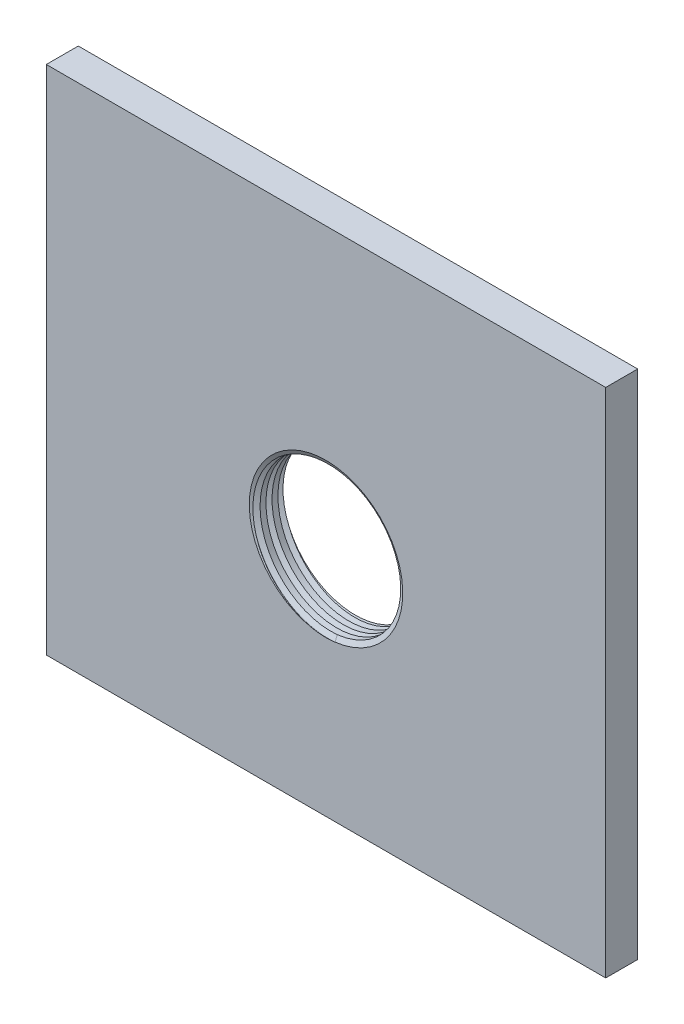
from build123d import *

# Parameters (mm, degrees)
SKETCH1_W           = 35
SKETCH1_H           = 35
BOSS_EXTRUDE1_DEPTH = 2
CUT_EXTRUDE1_REACH  = 51.538
SKETCH2_R           = 4.5
CUT_SWEEP9_PITCH    = 0.75
SKETCH26_W          = 35
SKETCH26_H          = 2
CUT_EXTRUDE4_DEPTH  = 3


with BuildPart() as part:
    # Sketch1 → Boss-Extrude1 (new body)
    with BuildSketch(Plane.XY):
        with Locations((17.5, 17.5)):
            Rectangle(SKETCH1_W, SKETCH1_H)
    extrude(amount=BOSS_EXTRUDE1_DEPTH)

    # Sketch2 → Cut-Extrude1 (cut, up to next)
    with BuildSketch(Plane.XY.offset(2), mode=Mode.PRIVATE) as cut_extrude1_sk1:
        with Locations((17.5, 17.5)):
            Circle(SKETCH2_R)
    cut_extrude1_tool1 = extrude(cut_extrude1_sk1.sketch, amount=-CUT_EXTRUDE1_REACH, mode=Mode.PRIVATE) & part.part
    add(cut_extrude1_tool1.solids().sort_by_distance((17.5, 17.5, 2))[0], mode=Mode.SUBTRACT)

    # Cut-Sweep9: the profile of Sketch22 profile screwed along a right-hand helix of 3 turns, 8 arcs to a turn; built about Z, then put on its axis
    cut_sweep9_z = Axis((0, 0, 0), (0, 0, 1))
    cut_sweep9_corners = [(4.4997, 0, -0.382379083), (4.4997, 0, 0.000173205), (4.801, 0, -0.173782431), (4.811, 0, -0.191102939), (4.801, 0, -0.208423447)]
    with BuildLine(mode=Mode.PRIVATE) as cut_sweep9_profile:
        Line(cut_sweep9_corners[0], cut_sweep9_corners[1])
        Line(cut_sweep9_corners[1], cut_sweep9_corners[2])
        Line(cut_sweep9_corners[4], cut_sweep9_corners[0])
        ThreePointArc((4.801, 0, -0.173782431), (4.808320508, 0, -0.181102939), (4.811, 0, -0.191102939))
        ThreePointArc((4.811, 0, -0.191102939), (4.808320508, 0, -0.201102939), (4.801, 0, -0.208423447))
    cut_sweep9_cap = Face(cut_sweep9_profile.wire())
    cut_sweep9_arcs = [((4.801, 0, -0.173782431), (4.811, 0, -0.179555934), (4.811, 0, -0.191102939), (1, 0.8660254037844068, 1)), ((4.811, 0, -0.191102939), (4.811, 0, -0.202649944), (4.801, 0, -0.208423447), (1, 0.8660254037844068, 1))]  # start, shoulder, end, weights
    cut_sweep9_turn_angles = [0, 22.5, 45, 67.5, 90, 112.5, 135, 157.5, 180, 202.5, 225, 247.5, 270, 292.5, 315, 337.5, 360]
    cut_sweep9_turn_weights = [1, 0.9238795325112867, 1, 0.9238795325112867, 1, 0.9238795325112867, 1, 0.9238795325112867, 1, 0.9238795325112867, 1, 0.9238795325112867, 1, 0.9238795325112867, 1, 0.9238795325112867, 1]
    cut_sweep9_turn_rails = [Edge.make_bspline([Vector(p[0], p[1], 0).rotate(cut_sweep9_z, cut_sweep9_turn_angles[k]) / cut_sweep9_turn_weights[k] + Vector(0, 0, p[2] + CUT_SWEEP9_PITCH * cut_sweep9_turn_angles[k] / 360) for k in range(17)], [0, 0, 0, 1, 1, 2, 2, 3, 3, 4, 4, 5, 5, 6, 6, 7, 7, 8, 8, 8], 2, cut_sweep9_turn_weights) for p in cut_sweep9_corners]
    cut_sweep9_turn_sides = [*[Face.make_surface_from_curves(cut_sweep9_turn_rails[p[0]], cut_sweep9_turn_rails[p[1]]) for p in [(0, 1), (1, 2), (4, 0)]], *[Face.make_bezier_surface([[Vector(p[j][0], p[j][1], 0).rotate(cut_sweep9_z, cut_sweep9_turn_angles[2 * i + k]) / cut_sweep9_turn_weights[2 * i + k] + Vector(0, 0, p[j][2] + CUT_SWEEP9_PITCH * cut_sweep9_turn_angles[2 * i + k] / 360) for k in range(3)] for j in range(3)], [[p[3][j] * cut_sweep9_turn_weights[2 * i + k] for k in range(3)] for j in range(3)]) for p in cut_sweep9_arcs for i in range(8)]]
    cut_sweep9 = Plane(origin=(17.5, 17.5, 2), x_dir=(1, 0, 0), z_dir=(0, 0, -1)) * Solid(Shell([*[p.moved(Location((0, 0, CUT_SWEEP9_PITCH * i))) for i in range(3) for p in cut_sweep9_turn_sides], cut_sweep9_cap, cut_sweep9_cap.rotate(cut_sweep9_z, 1080).moved(Location((0, 0, CUT_SWEEP9_PITCH * 1080 / 360)))]))
    add(cut_sweep9, mode=Mode.SUBTRACT)

    # Cut-Extrude2 cone 1 section (through the dimple's axis) → Cut-Extrude2 (revolve, cut)
    with BuildSketch(Plane(origin=(17.5, 17.5, 2), x_dir=(0, -1, 0), z_dir=(1, 0, 0))):
        Polygon((0, 0), (4.801, 0), (0, 2.771858642), align=None)
    revolve(axis=Axis((17.5, 17.5, 2), (0, 0, -1)), mode=Mode.SUBTRACT)

    # Cut-Extrude3 cone 1 section (through the dimple's axis) → Cut-Extrude3 (revolve, cut)
    with BuildSketch(Plane(origin=(17.5, 17.5, 0), x_dir=(0, 1, 0), z_dir=(1, 0, 0))):
        Polygon((0, 0), (4.801, 0), (0, 2.771858642), align=None)
    revolve(axis=Axis((17.5, 17.5, 0), (0, 0, 1)), mode=Mode.SUBTRACT)

    # Sketch26 → Cut-Extrude4 (cut)
    with BuildSketch(Plane.XZ):
        with Locations((17.5, 1)):
            Rectangle(SKETCH26_W, SKETCH26_H)
    extrude(amount=-CUT_EXTRUDE4_DEPTH, mode=Mode.SUBTRACT)


solid = part.part
